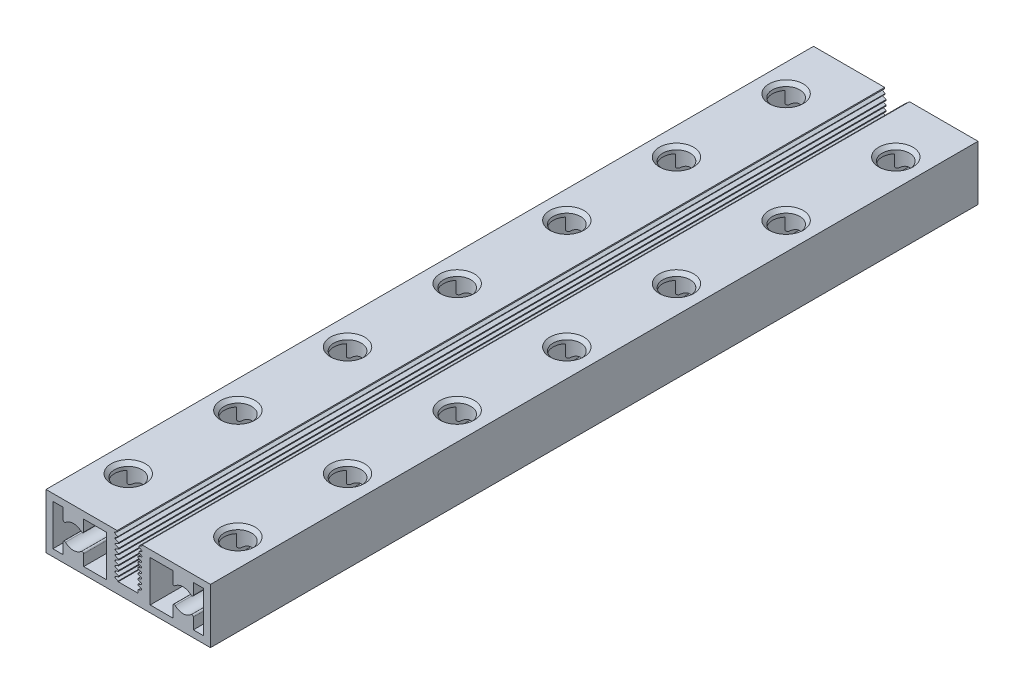
from build123d import *
from OCP.BRepFilletAPI import BRepFilletAPI_MakeChamfer

# Parameters (mm, degrees)
SKETCH1_W                    = 24
SKETCH1_H                    = 112
BOSS_EXTRUDE1_DEPTH          = 8
CUT_EXTRUDE1_DEPTH           = 113.924753708
CUT_EXTRUDE2_DEPTH           = 113.924753708
CUT_EXTRUDE3_DEPTH           = 113.924753708
F_4_0_4_DIAMETER_HOLE1_D     = 4
F_4_0_4_DIAMETER_HOLE1_DEPTH = 10.814359354
CHAMFER1_SIZE                = 0.168999185
CHAMFER1_SIZE2               = 0.180933856
CHAMFER2_SIZE                = 0.5
CHAMFER3_SIZE                = 0.086213795
CHAMFER3_SIZE2               = 0.080527003


with BuildPart() as part:
    # Sketch1 → Boss-Extrude1 (new body)
    with BuildSketch(Plane(origin=(0, 8, 0), x_dir=(1, 0, 0), z_dir=(0, 1, 0))):
        with Locations((0, -56)):
            Rectangle(SKETCH1_W, SKETCH1_H)
    extrude(amount=-BOSS_EXTRUDE1_DEPTH)

    # Sketch2 → Cut-Extrude1 (cut, through all)
    with BuildSketch(Plane.XY.offset(112)):
        Polygon((2, 8), (-1.62, 8), (-1.62, 7.825), (-2.074663337, 7.5625), (-1.468445554, 7.2125), (-2.087849868, 6.854886753), (-1.240412917, 6.5125), (-2.106693316, 6.1625), (-1.240412917, 5.8125), (-2.106693316, 5.4625), (-1.240412917, 5.1125), (-2.106693316, 4.7625), (-1.240412917, 4.4125), (-2.106693316, 4.0625), (-1.240412917, 3.7125), (-2.106693316, 3.3625), (-1.240412917, 3.0125), (-2.106693316, 2.6625), (-1.240412917, 2.3125), (-2.106693316, 1.9625), (-1.46, 1.70121894), (-1.46, 1.6), (1.46, 1.6), (1.46, 2.061825838), (2.106693316, 2.323106898), (1.240412917, 2.673106898), (2.106693316, 3.023106898), (1.240412917, 3.373106898), (2.106693316, 3.723106898), (1.240412917, 4.073106898), (2.106693316, 4.423106898), (1.240412917, 4.773106898), (2.106693316, 5.123106898), (1.240412917, 5.473106898), (2.106693316, 5.823106898), (1.240412917, 6.173106898), (2.087849868, 6.515493651), (1.468445554, 6.873106898), (2.074663337, 7.223106898), (1.468445554, 7.573106898), (2, 7.88), align=None)
    extrude(amount=-CUT_EXTRUDE1_DEPTH, mode=Mode.SUBTRACT)

    # Sketch3 → Cut-Extrude2 (cut, through all)
    with BuildSketch(Plane(origin=(0, 0, 0), x_dir=(-1, 0, 0), z_dir=(0, 0, -1))):
        with BuildLine():
            Line((-6.5, 2.614359354), (-6.5, 1))
            Line((-6.5, 1), (-3.2, 1))
            Line((-3.2, 1), (-3.2, 7))
            Line((-3.2, 7), (-6.5, 7))
            Line((-6.5, 7), (-6.5, 5.385640646))
            ThreePointArc((-6.5, 5.385640646), (-6.620528059, 5.202108059), (-6.836842105, 5.239783736))
            ThreePointArc((-6.836842105, 5.239783736), (-8, 5.7), (-9.163157895, 5.239783736))
            ThreePointArc((-9.163157895, 5.239783736), (-9.379471941, 5.202108059), (-9.5, 5.385640646))
            Line((-9.5, 5.385640646), (-9.5, 7))
            Line((-9.5, 7), (-11, 7))
            Line((-11, 7), (-11, 1))
            Line((-11, 1), (-9.5, 1))
            Line((-9.5, 1), (-9.5, 2.614359354))
            ThreePointArc((-9.5, 2.614359354), (-9.379471941, 2.797891941), (-9.163157895, 2.760216264))
            ThreePointArc((-9.163157895, 2.760216264), (-8, 2.3), (-6.836842105, 2.760216264))
            ThreePointArc((-6.836842105, 2.760216264), (-6.620528059, 2.797891941), (-6.5, 2.614359354))
        make_face()
    extrude(amount=-CUT_EXTRUDE2_DEPTH, mode=Mode.SUBTRACT)

    # Sketch4 → Cut-Extrude3 (cut, through all)
    with BuildSketch(Plane.XY.offset(112)):
        with BuildLine():
            Line((-9.5, 7), (-11, 7))
            Line((-11, 7), (-11, 1))
            Line((-11, 1), (-9.5, 1))
            Line((-9.5, 1), (-9.5, 2.614359354))
            ThreePointArc((-9.5, 2.614359354), (-9.379471941, 2.797891941), (-9.163157895, 2.760216264))
            ThreePointArc((-9.163157895, 2.760216264), (-8, 2.3), (-6.836842105, 2.760216264))
            ThreePointArc((-6.836842105, 2.760216264), (-6.620528059, 2.797891941), (-6.5, 2.614359354))
            Line((-6.5, 2.614359354), (-6.5, 1))
            Line((-6.5, 1), (-3.2, 1))
            Line((-3.2, 1), (-3.2, 7))
            Line((-3.2, 7), (-6.5, 7))
            Line((-6.5, 7), (-6.5, 5.385640646))
            ThreePointArc((-6.5, 5.385640646), (-6.620528059, 5.202108059), (-6.836842105, 5.239783736))
            ThreePointArc((-6.836842105, 5.239783736), (-8, 5.7), (-9.163157895, 5.239783736))
            ThreePointArc((-9.163157895, 5.239783736), (-9.379471941, 5.202108059), (-9.5, 5.385640646))
            Line((-9.5, 5.385640646), (-9.5, 7))
        make_face()
    extrude(amount=-CUT_EXTRUDE3_DEPTH, mode=Mode.SUBTRACT)

    # Ø4.0 (4) Diameter Hole1
    with Locations(Plane(origin=(0, 8, 0), x_dir=(1, 0, 0), z_dir=(0, 1, 0))):
        with Locations((-8, -88), (-8, -104), (-8, -72), (-8, -56), (-8, -40), (-8, -24), (-8, -8), (8, -8), (8, -24), (8, -40), (8, -56), (8, -72), (8, -88), (8, -104)):
            Hole(F_4_0_4_DIAMETER_HOLE1_D / 2, depth=F_4_0_4_DIAMETER_HOLE1_DEPTH)

    # Chamfer1: one chamfer whose edges measure the first distance from different faces: ONE call of the kernel's chamfer builder (chamfer() names one face for all edges)
    chamfer1_edges_1 = [part.edges().sort_by_distance(p)[0] for p in [
        (1.240412917, 4.773106898, 56),
        (-1.240412917, 4.4125, 56),
        (-2.106693316, 4.7625, 56),
        (-1.240412917, 5.1125, 56),
        (-2.106693316, 5.4625, 56),
        (2.106693316, 5.123106898, 56),
        (2.106693316, 4.423106898, 56),
        (-2.106693316, 4.0625, 56),
        (-1.240412917, 3.7125, 56),
        (1.240412917, 5.473106898, 56),
        (1.240412917, 4.073106898, 56),
        (-1.240412917, 5.8125, 56),
        (-2.106693316, 6.1625, 56),
        (2.106693316, 5.823106898, 56),
        (2.106693316, 3.723106898, 56),
        (-2.106693316, 3.3625, 56),
        (-1.240412917, 3.0125, 56),
        (1.240412917, 6.173106898, 56),
        (1.240412917, 3.373106898, 56),
        (-1.240412917, 6.5125, 56),
        (2.106693316, 3.023106898, 56),
        (-2.106693316, 2.6625, 56),
        (-1.240412917, 2.3125, 56),
        (1.240412917, 2.673106898, 56),
        (2.106693316, 2.323106898, 56),
        (-2.106693316, 1.9625, 56),
    ]]
    chamfer1_edges_2 = [part.edges().sort_by_distance(p)[0] for p in [
        (-2.087849868, 6.854886753, 56),
    ]]
    chamfer1_side_2 = [part.faces().sort_by_distance(p)[0] for p in [
        (-1.664131392, 6.683693376, 56),
    ]]
    chamfer1 = BRepFilletAPI_MakeChamfer(part.part.solid().wrapped)
    for e in chamfer1_edges_1:
        chamfer1.Add(CHAMFER1_SIZE, e.wrapped)
    for e in chamfer1_edges_2:
        chamfer1.Add(CHAMFER1_SIZE, CHAMFER1_SIZE2, e.wrapped, chamfer1_side_2[0].wrapped)  # the first distance lies on this face
    add(Compound.cast(chamfer1.Shape()), mode=Mode.REPLACE)

    # Chamfer2
    chamfer2_edges = [part.edges().sort_by_distance(p)[0] for p in [
        (-6, 0, 8),
        (-6, 8, 104),
        (-6, 0, 72),
        (-6, 8, 40),
        (10, 8, 56),
        (-6, 0, 40),
        (-6, 0, 104),
        (-6, 8, 8),
        (-6, 8, 72),
        (10, 8, 24),
        (10, 8, 88),
        (-6, 0, 24),
        (-6, 0, 56),
        (-6, 0, 88),
        (-6, 8, 24),
        (-6, 8, 56),
        (-6, 8, 88),
        (10, 8, 8),
        (10, 8, 40),
        (10, 8, 72),
        (10, 8, 104),
        (10, 0, 8),
        (10, 0, 24),
        (10, 0, 40),
        (10, 0, 56),
        (10, 0, 72),
        (10, 0, 88),
        (10, 0, 104),
    ]]
    chamfer(chamfer2_edges, length=CHAMFER2_SIZE)

    # Chamfer3: one chamfer whose edges measure the first distance from different faces: ONE call of the kernel's chamfer builder (chamfer() names one face for all edges)
    chamfer3_edges_1 = [part.edges().sort_by_distance(p)[0] for p in [
        (-2.074663337, 7.5625, 56),
        (1.468445554, 7.573106898, 56),
        (2.074663337, 7.223106898, 56),
        (1.468445554, 6.873106898, 56),
        (-1.468445554, 7.2125, 56),
    ]]
    chamfer3_edges_2 = [part.edges().sort_by_distance(p)[0] for p in [
        (2.087849868, 6.515493651, 56),
    ]]
    chamfer3_side_2 = [part.faces().sort_by_distance(p)[0] for p in [
        (1.778147711, 6.694300274, 56),
    ]]
    chamfer3 = BRepFilletAPI_MakeChamfer(part.part.solid().wrapped)
    for e in chamfer3_edges_1:
        chamfer3.Add(CHAMFER3_SIZE, e.wrapped)
    for e in chamfer3_edges_2:
        chamfer3.Add(CHAMFER3_SIZE, CHAMFER3_SIZE2, e.wrapped, chamfer3_side_2[0].wrapped)  # the first distance lies on this face
    add(Compound.cast(chamfer3.Shape()), mode=Mode.REPLACE)


solid = part.part
